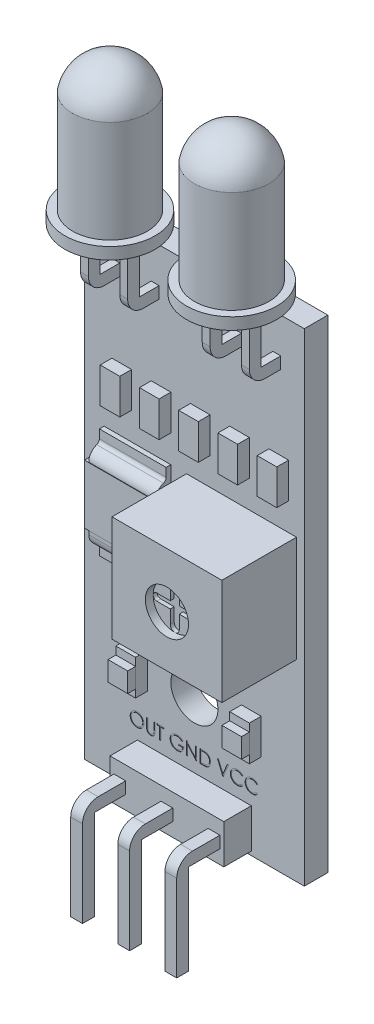
from build123d import *

# Parameters (mm, degrees)
SKETCH1_W               = 14.224
SKETCH1_H               = 31.242
BOSS_EXTRUDE1_DEPTH     = 0.762
SKETCH2_W               = 7.366
SKETCH2_H               = 2.54
BOSS_EXTRUDE2_DEPTH     = 1.778
BOSS_EXTRUDE3_START     = -4.318
SKETCH5_W               = 0.762
SKETCH5_H               = 0.762
BOSS_EXTRUDE3_DEPTH     = 6.35
SKETCH6_W               = 0.762
SKETCH6_H               = 0.762
BOSS_EXTRUDE4_DEPTH     = 6.604
LPATTERN1_COUNT         = 3
LPATTERN1_PITCH         = 3.048
CUT_EXTRUDE1_DEPTH      = 0.0254
CUT_EXTRUDE2_DEPTH      = 23.008773919
CUT_EXTRUDE2_DEPTH_BACK = 23.008773919
SKETCH8_R               = 1.524
SKETCH9_W               = 1.27
SKETCH9_H               = 2.286
BOSS_EXTRUDE5_DEPTH     = 0.762
SKETCH10_W              = 1.27
SKETCH10_H              = 1.27
BOSS_EXTRUDE6_DEPTH     = 0.508
LPATTERN2_START         = 3.048
LPATTERN2_OUTLINE_W     = 1.27
LPATTERN2_OUTLINE_H     = 0.508
LPATTERN2_DEPTH         = 1.27
LPATTERN2_START_2       = -9.779
LPATTERN2_2_OUTLINE_W   = 1.27
LPATTERN2_2_OUTLINE_H   = 0.762
LPATTERN2_2_DEPTH       = 2.286
SKETCH12_W              = 2.286
SKETCH12_H              = 1.27
BOSS_EXTRUDE7_DEPTH     = 0.762
LPATTERN3_COUNT         = 2
LPATTERN3_PITCH         = 5.842
SKETCH16_W              = 7.112
SKETCH16_H              = 6.858
BOSS_EXTRUDE9_DEPTH     = 4.826
SKETCH17_R              = 1.397
CUT_EXTRUDE3_DEPTH      = 0.508
CUT_EXTRUDE4_DEPTH      = 0.254
SKETCH19_W              = 1.27
SKETCH19_H              = 2.286
BOSS_EXTRUDE10_DEPTH    = 0.762
LPATTERN4_COUNT         = 5
LPATTERN4_PITCH         = 2.54
BOSS_EXTRUDE11_START    = -2.794
SKETCH20_W              = 0.508
SKETCH20_H              = 0.762
BOSS_EXTRUDE11_DEPTH    = 4.064
SKETCH21_W              = 0.508
SKETCH21_H              = 0.762
BOSS_EXTRUDE12_DEPTH    = 4.318
FILLET1_R               = 1.016
FILLET2_R               = 1.016
LPATTERN5_COUNT         = 2
LPATTERN5_PITCH         = 2.54
FILLET1_OF_LPATTERN5_R  = 1.016
LPATTERN6_START         = -5.334
LPATTERN6_OUTLINE_W     = 0.762
LPATTERN6_OUTLINE_H     = 1.27
LPATTERN6_DEPTH         = 0.508
LPATTERN6_START_2       = -2.794
LPATTERN6_2_OUTLINE_W   = 0.762
LPATTERN6_2_OUTLINE_H   = 1.27
LPATTERN6_2_DEPTH       = 0.508
SKETCH31_W              = 4.826
SKETCH31_H              = 3.81
BOSS_EXTRUDE14_DEPTH    = 1.016
SKETCH32_W              = 4.318
SKETCH32_H              = 7.112
BOSS_EXTRUDE15_DEPTH    = 0.9906
SKETCH33_W              = 4.318
SKETCH33_H              = 0.762
CUT_EXTRUDE5_DEPTH      = 0.6858
FILLET4_R               = 0.762
FILLET5_R               = 0.254


with BuildPart() as part:
    # Sketch1 → Boss-Extrude1 (new, symmetric)
    with BuildSketch(Plane.XY):
        Rectangle(SKETCH1_W, SKETCH1_H)
    extrude(amount=BOSS_EXTRUDE1_DEPTH, both=True)

    # Sketch2 → Boss-Extrude2 (add)
    with BuildSketch(Plane.XY.offset(0.762)):
        with Locations((0, -14.097)):
            Rectangle(SKETCH2_W, SKETCH2_H)
    extrude(amount=BOSS_EXTRUDE2_DEPTH)

    # Sketch5 → Boss-Extrude3 (add)
    with BuildSketch(Plane.XY.offset(2.54).offset(BOSS_EXTRUDE3_START)):
        with Locations((-3.048, -14.097)):
            Rectangle(SKETCH5_W, SKETCH5_H)
    boss_extrude3 = extrude(amount=BOSS_EXTRUDE3_DEPTH)

    # Sketch6 → Boss-Extrude4 (add)
    with BuildSketch(Plane(origin=(0, -13.716, 0), x_dir=(1, 0, 0), z_dir=(0, 1, 0))):
        with Locations((-3.048, -4.953)):
            Rectangle(SKETCH6_W, SKETCH6_H)
    boss_extrude4 = extrude(amount=-BOSS_EXTRUDE4_DEPTH)

    # LPattern1: Boss-Extrude3, Boss-Extrude4 ×3
    with Locations(*[(i * LPATTERN1_PITCH, 0, 0) for i in range(1, LPATTERN1_COUNT)]):
        add(boss_extrude3)
        add(boss_extrude4)

    # Sketch7 → Cut-Extrude1 (cut)
    # profile 1 of 9: a face of its own
    with BuildSketch(Plane.XY.offset(0.762)):
        with BuildLine():
            add(Edge.make_bspline(
                [(-3.713008127, -11.244319932), (-3.697330739, -11.244717014), (-3.666539056, -11.245496915), (-3.621284752, -11.251466907), (-3.578081752, -11.261795124), (-3.536578123, -11.275550549), (-3.497270302, -11.293900084), (-3.459862421, -11.316079156), (-3.424443486, -11.342320125), (-3.391490888, -11.372420145), (-3.361335781, -11.405170043), (-3.334768379, -11.440119934), (-3.312502912, -11.477058498), (-3.294218352, -11.515874733), (-3.279873738, -11.556480855), (-3.269975227, -11.599093343), (-3.263652285, -11.643436099), (-3.262913078, -11.67368069), (-3.262538087, -11.689023413)],
                knots=[0, 0, 0, 0, 1.065120563, 2.091984664, 3.0946048, 4.079830382, 5.057816894, 6.036188127, 7.030412546, 8.04752943, 9.064399622, 10.05169764, 11.02544977, 11.989514704, 12.962713494, 13.945757189, 14.957906945, 16, 16, 16, 16], degree=3))
            add(Edge.make_bspline(
                [(-3.262538087, -11.689023413), (-3.262913023, -11.704253118), (-3.263652065, -11.73427263), (-3.269982416, -11.778333992), (-3.279910429, -11.820689261), (-3.294085143, -11.861267729), (-3.312282543, -11.900112202), (-3.334696268, -11.937120471), (-3.361098044, -11.972304668), (-3.391144269, -12.005279348), (-3.423898423, -12.035516828), (-3.459030312, -12.06186482), (-3.495749836, -12.08453713), (-3.534529514, -12.102627655), (-3.574855042, -12.117086766), (-3.617087333, -12.12694502), (-3.661028495, -12.133303981), (-3.690993478, -12.134034174), (-3.70622394, -12.134405313)],
                knots=[0, 0, 0, 0, 1.043624062, 2.057103931, 3.04512605, 4.022047818, 4.998200453, 5.980619268, 6.982898556, 8.009068085, 9.034988726, 10.034168286, 11.015286542, 11.987931943, 12.962482838, 13.94673481, 14.956375938, 16, 16, 16, 16], degree=3))
            add(Edge.make_bspline(
                [(-3.70622394, -12.134405313), (-3.721566583, -12.134030509), (-3.751811017, -12.133291671), (-3.796209495, -12.126958265), (-3.838851917, -12.117054369), (-3.879616337, -12.10290066), (-3.918525487, -12.084608493), (-3.955655465, -12.062303817), (-3.990857237, -12.035837711), (-4.023838951, -12.005801229), (-4.054016373, -11.97310259), (-4.080325781, -11.938066497), (-4.102635473, -11.901380324), (-4.12086622, -11.86294226), (-4.135299336, -11.822938124), (-4.145146024, -11.781101068), (-4.151516816, -11.737669611), (-4.152250959, -11.708098475), (-4.152623468, -11.693093926)],
                knots=[0, 0, 0, 0, 1.053102029, 2.075944431, 3.073151272, 4.055350789, 5.033113405, 6.020478099, 7.024410459, 8.052272461, 9.079885166, 10.07527673, 11.055994387, 12.023226415, 12.992069828, 13.970394897, 14.97016774, 16, 16, 16, 16], degree=3))
            add(Edge.make_bspline(
                [(-4.152623468, -11.693093926), (-4.152494137, -11.683022786), (-4.152237107, -11.663007558), (-4.149142736, -11.633285545), (-4.144652572, -11.604041522), (-4.138217444, -11.575358648), (-4.129801175, -11.547307137), (-4.119870495, -11.519693526), (-4.107741429, -11.492797657), (-4.094030111, -11.466492115), (-4.07872678, -11.441186967), (-4.061823505, -11.417267527), (-4.043913999, -11.394533079), (-4.024280189, -11.373572758), (-4.003569166, -11.353776809), (-3.981444951, -11.335449449), (-3.958042544, -11.318425415), (-3.933261247, -11.303083734), (-3.907711685, -11.289208288), (-3.881373877, -11.277301289), (-3.854605528, -11.267081766), (-3.827281264, -11.258798748), (-3.799473643, -11.252259571), (-3.771121977, -11.247806745), (-3.74224885, -11.244704481), (-3.722796971, -11.244448667), (-3.713008127, -11.244319932)],
                knots=[0, 0, 0, 0, 1.037015668, 2.060948919, 3.074880161, 4.083647147, 5.086022904, 6.090072063, 7.104153813, 8.122640571, 9.144368836, 10.147691507, 11.138137339, 12.123020368, 13.103399296, 14.087645067, 15.080126199, 16.082011238, 17.087798457, 18.072939717, 19.057185487, 20.037253025, 21.01195951, 21.997135196, 22.992090687, 24, 24, 24, 24], degree=3))
        make_face()
        with BuildLine():
            add(Edge.make_bspline(
                [(-3.709276824, -11.33115753), (-3.717311601, -11.331255475), (-3.733304343, -11.331450428), (-3.757079838, -11.33401842), (-3.780542646, -11.337678412), (-3.803697613, -11.342899084), (-3.826447856, -11.350012064), (-3.849005435, -11.35819834), (-3.871164647, -11.368169917), (-3.89285234, -11.379436075), (-3.913877509, -11.391906003), (-3.93371677, -11.405687743), (-3.952421484, -11.420458097), (-3.969945853, -11.436251534), (-3.986238421, -11.453148484), (-4.001619861, -11.470892786), (-4.015473644, -11.489991622), (-4.028170154, -11.50992709), (-4.039531897, -11.530673223), (-4.049635134, -11.552011606), (-4.05789957, -11.574116302), (-4.064639611, -11.596747496), (-4.070227564, -11.619869346), (-4.07376758, -11.643657253), (-4.076363789, -11.667991687), (-4.076547599, -11.68443682), (-4.076640569, -11.692754716)],
                knots=[0, 0, 0, 0, 1.008559885, 2.007477868, 2.99961109, 3.989939068, 4.984837346, 5.991145699, 7.001802488, 8.033829008, 9.059044045, 10.069351652, 11.065060232, 12.050310815, 13.029377138, 14.011219647, 14.996725999, 15.989392538, 16.977580475, 17.965360261, 18.951710183, 19.937753436, 20.929683414, 21.935841486, 22.955955122, 24, 24, 24, 24], degree=3))
            add(Edge.make_bspline(
                [(-4.076640569, -11.692754716), (-4.076332174, -11.704985957), (-4.075725466, -11.729048591), (-4.070413825, -11.764310596), (-4.06223213, -11.798198616), (-4.050171396, -11.830527227), (-4.035088487, -11.861574317), (-4.016455318, -11.891064465), (-3.994379312, -11.919005642), (-3.969302614, -11.94520278), (-3.941889315, -11.969114049), (-3.912780257, -11.990102528), (-3.882287292, -12.007860816), (-3.850330902, -12.022327946), (-3.817081691, -12.033791748), (-3.782325411, -12.041648483), (-3.746293589, -12.046819307), (-3.721732842, -12.047315878), (-3.709276824, -12.047567715)],
                knots=[0, 0, 0, 0, 1.032063989, 2.030389145, 3.003944642, 3.970395727, 4.937377036, 5.913328081, 6.909231446, 7.93887556, 8.970685674, 9.976071282, 10.964166581, 11.944589148, 12.933237628, 13.927779006, 14.949070134, 16, 16, 16, 16], degree=3))
            add(Edge.make_bspline(
                [(-3.709276824, -12.047567715), (-3.700904622, -12.047452688), (-3.68430003, -12.047224556), (-3.659602639, -12.044926781), (-3.635350187, -12.041242119), (-3.611576689, -12.03593699), (-3.588309127, -12.029297381), (-3.565450387, -12.021409417), (-3.543243945, -12.011568441), (-3.521409663, -12.000695318), (-3.500510003, -11.988300081), (-3.480558781, -11.974986092), (-3.462058879, -11.960237494), (-3.44454762, -11.944678711), (-3.428188161, -11.927996029), (-3.413091132, -11.910211139), (-3.399307368, -11.891211782), (-3.38661568, -11.871306552), (-3.375293749, -11.850503651), (-3.365429092, -11.829087903), (-3.357060127, -11.807112041), (-3.35030409, -11.784544367), (-3.345009893, -11.761427745), (-3.341361989, -11.737731222), (-3.338810272, -11.713502203), (-3.338617939, -11.697114643), (-3.338520985, -11.688853809)],
                knots=[0, 0, 0, 0, 1.047197238, 2.076906641, 3.100256066, 4.114471768, 5.12198147, 6.126382909, 7.136867548, 8.15857795, 9.17633901, 10.174870724, 11.156907918, 12.133735059, 13.104061851, 14.077631395, 15.04955518, 16.038496417, 17.029181396, 18.010275684, 18.986308667, 19.968651475, 20.955262928, 21.950658345, 22.966943676, 24, 24, 24, 24], degree=3))
            add(Edge.make_bspline(
                [(-3.338520985, -11.688853809), (-3.338618016, -11.680649487), (-3.338810495, -11.664374705), (-3.34136077, -11.640314662), (-3.345013747, -11.616788649), (-3.350278249, -11.593889027), (-3.357063714, -11.571609957), (-3.365430553, -11.549972365), (-3.37529671, -11.528895642), (-3.386619842, -11.508431881), (-3.399347859, -11.488795327), (-3.413255988, -11.470022936), (-3.428584366, -11.452467246), (-3.444895041, -11.435694855), (-3.462595425, -11.420063481), (-3.481605338, -11.40556794), (-3.501693997, -11.391858406), (-3.522964012, -11.37949089), (-3.544915404, -11.368069544), (-3.567440112, -11.358284255), (-3.590282959, -11.349969476), (-3.613385856, -11.342877563), (-3.63694326, -11.337698859), (-3.660795993, -11.334015122), (-3.684911055, -11.331451322), (-3.701129127, -11.331255772), (-3.709276824, -11.33115753)],
                knots=[0, 0, 0, 0, 1.02996197, 2.043119294, 3.035359645, 4.018872909, 4.991431989, 5.957985074, 6.929999688, 7.912076566, 8.892894881, 9.867085534, 10.843653904, 11.817741046, 12.803660682, 13.806313499, 14.818574707, 15.856120519, 16.894564902, 17.924820532, 18.937903209, 19.946497019, 20.957711757, 21.963978472, 22.977135795, 24, 24, 24, 24], degree=3))
        make_face(mode=Mode.SUBTRACT)
    # profile 2 of 9: a face of its own
    with BuildSketch(Plane.XY.offset(0.762)):
        with BuildLine():
            Line((-3.08886289, -11.266029332), (-3.012879992, -11.266029332))
            Line((-3.012879992, -11.266029332), (-3.012879992, -11.773316941))
            add(Edge.make_bspline(
                [(-3.012879992, -11.773316941), (-3.0128913, -11.780496852), (-3.012912758, -11.794121969), (-3.012769426, -11.813515061), (-3.012368017, -11.830756207), (-3.012114946, -11.845911864), (-3.011551953, -11.85891249), (-3.011092806, -11.869828516), (-3.010502424, -11.878608256), (-3.009792889, -11.883732022), (-3.009487898, -11.885934451)],
                knots=[0, 0, 0, 0, 1.528628734, 2.90083645, 4.128790002, 5.200304208, 6.127813768, 6.898992206, 7.526736466, 8, 8, 8, 8], degree=3))
            add(Edge.make_bspline(
                [(-3.009487898, -11.885934451), (-3.008235447, -11.893880239), (-3.005801114, -11.909324098), (-2.999597134, -11.931315242), (-2.990932711, -11.95113485), (-2.980665538, -11.969401389), (-2.967135174, -11.985606432), (-2.950926701, -12.000534773), (-2.931289414, -12.013590809), (-2.909454946, -12.025529004), (-2.885921186, -12.035124175), (-2.86187313, -12.042379712), (-2.837672259, -12.046801465), (-2.821470408, -12.047313465), (-2.813424884, -12.047567715)],
                knots=[0, 0, 0, 0, 1.035780045, 2.013197591, 2.933192213, 3.817615948, 4.702609284, 5.640816605, 6.646850145, 7.73207398, 8.84249596, 9.914020372, 10.964143139, 12, 12, 12, 12], degree=3))
            add(Edge.make_bspline(
                [(-2.813424884, -12.047567715), (-2.806517599, -12.047307946), (-2.792742923, -12.046789907), (-2.772276227, -12.043581904), (-2.75234325, -12.037800244), (-2.732845564, -12.03033996), (-2.714569423, -12.020482925), (-2.69750463, -12.009096266), (-2.682273356, -11.995740493), (-2.668373994, -11.98096003), (-2.656270306, -11.964283166), (-2.645778621, -11.946073028), (-2.637184731, -11.926055569), (-2.632940869, -11.911987739), (-2.630760639, -11.904760571)],
                knots=[0, 0, 0, 0, 0.994687771, 1.983630487, 2.973142513, 3.978332533, 4.983357753, 5.956394766, 6.925816176, 7.893390482, 8.871859704, 9.88551698, 10.913711441, 12, 12, 12, 12], degree=3))
            add(Edge.make_bspline(
                [(-2.630760639, -11.904760571), (-2.630034895, -11.901773392), (-2.628417643, -11.895116755), (-2.626906454, -11.883863034), (-2.625332494, -11.870585037), (-2.624240398, -11.855187362), (-2.623175722, -11.837721604), (-2.62253877, -11.818096778), (-2.622244364, -11.796384144), (-2.622156629, -11.781231918), (-2.6221108, -11.773316941)],
                knots=[0, 0, 0, 0, 0.558680831, 1.244966039, 2.062412453, 2.990489873, 4.051219941, 5.244515665, 6.560634259, 8, 8, 8, 8], degree=3))
            Line((-2.6221108, -11.773316941), (-2.6221108, -11.266029332))
            Line((-2.6221108, -11.266029332), (-2.546127902, -11.266029332))
            Line((-2.546127902, -11.266029332), (-2.546127902, -11.777387454))
            add(Edge.make_bspline(
                [(-2.546127902, -11.777387454), (-2.546189375, -11.786603632), (-2.546309343, -11.804589564), (-2.547349673, -11.830945414), (-2.549008414, -11.85594699), (-2.551352008, -11.879597653), (-2.55445734, -11.901812771), (-2.557910583, -11.922787065), (-2.562308299, -11.942369977), (-2.567444759, -11.960714199), (-2.573316645, -11.978176216), (-2.580922408, -11.994748775), (-2.589491762, -12.010935685), (-2.599655306, -12.026492121), (-2.611075963, -12.041486962), (-2.624006178, -12.05582927), (-2.638018307, -12.069748238), (-2.653345284, -12.082886826), (-2.669734457, -12.094935781), (-2.687137074, -12.105530669), (-2.705419453, -12.114486858), (-2.72453407, -12.121859128), (-2.744489083, -12.127402278), (-2.765284994, -12.13153284), (-2.78696914, -12.133879871), (-2.801716779, -12.134228681), (-2.809184767, -12.134405313)],
                knots=[0, 0, 0, 0, 1.316592851, 2.569410997, 3.76748051, 4.895814652, 5.963796859, 6.97159953, 7.931736103, 8.829262218, 9.692595152, 10.560224239, 11.431080259, 12.30701507, 13.211635791, 14.121146779, 15.063487852, 16.031507147, 17.00238618, 17.966455255, 18.938106653, 19.907068911, 20.888905087, 21.893141452, 22.933117798, 24, 24, 24, 24], degree=3))
            add(Edge.make_bspline(
                [(-2.809184767, -12.134405313), (-2.817329482, -12.134215475), (-2.833309385, -12.133843012), (-2.856855924, -12.131708747), (-2.87942907, -12.127688679), (-2.901267233, -12.122569988), (-2.922073096, -12.115510304), (-2.942125413, -12.107261806), (-2.961080749, -12.097131498), (-2.979246616, -12.085860336), (-2.996137556, -12.073178568), (-3.011643021, -12.059356089), (-3.025788611, -12.044614323), (-3.038335895, -12.028793664), (-3.049492755, -12.012017158), (-3.059103682, -11.994237344), (-3.067355837, -11.975461105), (-3.071614949, -11.96240957), (-3.073768074, -11.955811581)],
                knots=[0, 0, 0, 0, 1.13879206, 2.234305948, 3.301075583, 4.341971843, 5.366689343, 6.369221514, 7.369726634, 8.367512178, 9.355451585, 10.318319045, 11.268648973, 12.207971039, 13.137398894, 14.081662264, 15.030215811, 16, 16, 16, 16], degree=3))
            add(Edge.make_bspline(
                [(-3.073768074, -11.955811581), (-3.075020453, -11.951304273), (-3.077736891, -11.941527821), (-3.080645867, -11.925347663), (-3.083091302, -11.90671739), (-3.085390742, -11.885635726), (-3.086747575, -11.862086332), (-3.087937127, -11.836079416), (-3.088871271, -11.807583531), (-3.088865762, -11.787734155), (-3.08886289, -11.777387454)],
                knots=[0, 0, 0, 0, 0.625038921, 1.35572334, 2.194682327, 3.136881307, 4.189498639, 5.346923369, 6.617055217, 8, 8, 8, 8], degree=3))
            Line((-3.08886289, -11.777387454), (-3.08886289, -11.266029332))
        make_face()
    # profile 3 of 9: a face of its own
    with BuildSketch(Plane.XY.offset(0.762)):
        Polygon((-2.426726205, -11.35286693), (-2.426726205, -11.266029332), (-1.981683514, -11.266029332), (-1.981683514, -11.35286693), (-2.16621341, -11.35286693), (-2.16621341, -12.112695914), (-2.242196308, -12.112695914), (-2.242196308, -11.35286693), align=None)
    # profile 4 of 9: a face of its own
    with BuildSketch(Plane.XY.offset(0.762)):
        with BuildLine():
            Line((-0.733393041, -11.410532522), (-0.798521239, -11.472268627))
            add(Edge.make_bspline(
                [(-0.798521239, -11.472268627), (-0.810306569, -11.461181924), (-0.833596201, -11.439272887), (-0.871565627, -11.410846421), (-0.911180826, -11.386494814), (-0.952235083, -11.366681308), (-0.99371172, -11.350872165), (-1.0350602, -11.339616788), (-1.075856395, -11.33243886), (-1.102990176, -11.331580493), (-1.116360417, -11.33115753)],
                knots=[0, 0, 0, 0, 1.08915593, 2.152340314, 3.188132944, 4.216796309, 5.218260357, 6.173443236, 7.099959455, 8, 8, 8, 8], degree=3))
            add(Edge.make_bspline(
                [(-1.116360417, -11.33115753), (-1.124564543, -11.331257583), (-1.140951519, -11.33145743), (-1.165292444, -11.334008126), (-1.189378085, -11.337676578), (-1.213162975, -11.342984423), (-1.23669336, -11.349711566), (-1.259887402, -11.358126334), (-1.282788368, -11.36793684), (-1.305180541, -11.379273094), (-1.326889194, -11.391726313), (-1.347392274, -11.405526625), (-1.366820466, -11.420231722), (-1.384808605, -11.436209767), (-1.401460163, -11.453316027), (-1.417171482, -11.471232292), (-1.431389988, -11.490448048), (-1.444232992, -11.51060975), (-1.455689992, -11.531363287), (-1.465803704, -11.552508903), (-1.474293856, -11.573976462), (-1.481011418, -11.595792901), (-1.486553614, -11.617789442), (-1.49045254, -11.640118391), (-1.492650661, -11.662803657), (-1.493030882, -11.677994612), (-1.493222024, -11.68563132)],
                knots=[0, 0, 0, 0, 1.02818874, 2.053710826, 3.065248034, 4.081641283, 5.106893873, 6.131558223, 7.173050175, 8.228653731, 9.27666206, 10.308777013, 11.325269123, 12.329503258, 13.32196095, 14.316845687, 15.314881793, 16.315733098, 17.311955233, 18.285320748, 19.252783886, 20.203351036, 21.145449891, 22.095197417, 23.042428769, 24, 24, 24, 24], degree=3))
            add(Edge.make_bspline(
                [(-1.493222024, -11.68563132), (-1.493039213, -11.693437783), (-1.492674088, -11.709029393), (-1.490337211, -11.732299195), (-1.486000285, -11.755223395), (-1.480202382, -11.777877322), (-1.472949881, -11.800299774), (-1.463909256, -11.822393541), (-1.453201198, -11.844157805), (-1.440806833, -11.865396464), (-1.427215124, -11.886084889), (-1.411988895, -11.905572619), (-1.395815003, -11.924119159), (-1.378104213, -11.941312723), (-1.35942444, -11.957613207), (-1.339217587, -11.972571513), (-1.317880994, -11.986475767), (-1.295382109, -11.999150734), (-1.271965057, -12.01047394), (-1.247954378, -12.020542958), (-1.223273366, -12.028835292), (-1.198051728, -12.035593652), (-1.172319529, -12.041133342), (-1.145946155, -12.044697199), (-1.119125521, -12.047283362), (-1.101045892, -12.047472451), (-1.091937342, -12.047567715)],
                knots=[0, 0, 0, 0, 0.93586088, 1.869166235, 2.799637598, 3.729985548, 4.670839027, 5.622275134, 6.589130586, 7.576015415, 8.568469353, 9.55398029, 10.53834874, 11.515998671, 12.510579167, 13.508179873, 14.527009472, 15.561807829, 16.601455013, 17.643573243, 18.680854198, 19.719860599, 20.772568776, 21.833555941, 22.908541556, 24, 24, 24, 24], degree=3))
            add(Edge.make_bspline(
                [(-1.091937342, -12.047567715), (-1.080960105, -12.04733825), (-1.059404516, -12.046887658), (-1.027718275, -12.043379969), (-0.997285917, -12.037901602), (-0.968192952, -12.029878615), (-0.940405592, -12.019645156), (-0.913821969, -12.00730913), (-0.88865138, -11.992397382), (-0.864818157, -11.975567134), (-0.842863564, -11.956815929), (-0.823062663, -11.936581939), (-0.80573128, -11.91496338), (-0.790611097, -11.892087582), (-0.778102529, -11.867765196), (-0.767835416, -11.842115417), (-0.759965458, -11.815126708), (-0.756734827, -11.796477877), (-0.75510244, -11.787054921)],
                knots=[0, 0, 0, 0, 1.13008108, 2.219097802, 3.278683437, 4.311054135, 5.322181354, 6.324827112, 7.324222904, 8.330512327, 9.32562643, 10.293043162, 11.24128371, 12.174520618, 13.111833804, 14.052305215, 15.015860969, 16, 16, 16, 16], degree=3))
            Line((-0.75510244, -11.787054921), (-1.037324634, -11.787054921))
            Line((-1.037324634, -11.787054921), (-1.037324634, -11.700217322))
            Line((-1.037324634, -11.700217322), (-0.679119542, -11.700217322))
            add(Edge.make_bspline(
                [(-0.679119542, -11.700217322), (-0.679532194, -11.716402561), (-0.680339831, -11.748079996), (-0.686004977, -11.79427661), (-0.695152971, -11.837909377), (-0.707649845, -11.879024249), (-0.723827292, -11.917562962), (-0.743511692, -11.953564644), (-0.767018089, -11.986796714), (-0.793509183, -12.01753047), (-0.823239265, -12.044945343), (-0.855405004, -12.069040492), (-0.890059544, -12.089336932), (-0.927170103, -12.105849509), (-0.966615194, -12.118736741), (-1.008486094, -12.127873864), (-1.052726019, -12.13334816), (-1.083045555, -12.134047598), (-1.098551925, -12.134405313)],
                knots=[0, 0, 0, 0, 1.140356446, 2.231883559, 3.274166699, 4.278491846, 5.25512956, 6.21435461, 7.1637429, 8.11826594, 9.068280886, 10.0076534, 10.945064095, 11.891975133, 12.864533718, 13.863980011, 14.907571808, 16, 16, 16, 16], degree=3))
            add(Edge.make_bspline(
                [(-1.098551925, -12.134405313), (-1.108109614, -12.13426764), (-1.126960457, -12.133996104), (-1.154801498, -12.132066346), (-1.1818749, -12.129095617), (-1.208176721, -12.124609463), (-1.233803708, -12.119114681), (-1.258627871, -12.112078466), (-1.282743776, -12.103933848), (-1.306188696, -12.094669943), (-1.328749832, -12.083936229), (-1.350527673, -12.072007994), (-1.3716426, -12.058946744), (-1.391950785, -12.044526598), (-1.41155804, -12.028855414), (-1.430337937, -12.011901782), (-1.448395613, -11.993717532), (-1.45970719, -11.980804896), (-1.465406856, -11.974298492)],
                knots=[0, 0, 0, 0, 1.107784379, 2.184907829, 3.233506516, 4.263428166, 5.276301166, 6.270063455, 7.25232949, 8.225834625, 9.190232166, 10.146266622, 11.1027726, 12.066435141, 13.031522626, 14.010570082, 14.99756817, 16, 16, 16, 16], degree=3))
            add(Edge.make_bspline(
                [(-1.465406856, -11.974298492), (-1.473676595, -11.963976258), (-1.490078804, -11.943503131), (-1.511191803, -11.910700862), (-1.529189855, -11.876736986), (-1.543793117, -11.841516956), (-1.555196044, -11.805073714), (-1.563373936, -11.767453828), (-1.568165414, -11.728608855), (-1.568855698, -11.702322212), (-1.569204923, -11.689023413)],
                knots=[0, 0, 0, 0, 1.023165419, 2.029347347, 3.013907458, 3.994755782, 4.975994455, 5.96558838, 6.970761222, 8, 8, 8, 8], degree=3))
            add(Edge.make_bspline(
                [(-1.569204923, -11.689023413), (-1.569076172, -11.679065102), (-1.568820306, -11.659275043), (-1.565717753, -11.629893944), (-1.561266363, -11.601034542), (-1.554723552, -11.572720425), (-1.546475504, -11.544932685), (-1.536181614, -11.517658418), (-1.524196469, -11.49088153), (-1.510266265, -11.46478633), (-1.494763931, -11.439719094), (-1.477939403, -11.415780733), (-1.459553772, -11.39340719), (-1.439907285, -11.372315117), (-1.418765539, -11.352769493), (-1.396326595, -11.334589357), (-1.37257316, -11.317750324), (-1.347430506, -11.302517622), (-1.321273907, -11.288834615), (-1.294166062, -11.276838749), (-1.266115245, -11.266924691), (-1.237331611, -11.258512749), (-1.207597285, -11.252292135), (-1.177128044, -11.247780915), (-1.145765067, -11.244694065), (-1.124565497, -11.244445809), (-1.113816346, -11.244319932)],
                knots=[0, 0, 0, 0, 1.008945113, 2.00506715, 2.99143336, 3.967273523, 4.948097931, 5.927297278, 6.919902385, 7.919676788, 8.923139349, 9.905703106, 10.883022732, 11.856032218, 12.825136022, 13.798837087, 14.781400844, 15.773989409, 16.776158564, 17.77167057, 18.775803737, 19.789618931, 20.80898985, 21.851988756, 22.910860228, 24, 24, 24, 24], degree=3))
            add(Edge.make_bspline(
                [(-1.113816346, -11.244319932), (-1.105050144, -11.244460114), (-1.087667794, -11.244738078), (-1.061801952, -11.246664764), (-1.036335911, -11.249718541), (-1.011231911, -11.253885782), (-0.98657544, -11.25956176), (-0.962296259, -11.26635403), (-0.938359171, -11.274262337), (-0.914839197, -11.283693923), (-0.89157819, -11.294399085), (-0.868446814, -11.306449188), (-0.845524103, -11.320050283), (-0.822770306, -11.335242756), (-0.800041939, -11.351765676), (-0.777698494, -11.37009161), (-0.755200642, -11.389497875), (-0.740734299, -11.403451469), (-0.733393041, -11.410532522)],
                knots=[0, 0, 0, 0, 0.985871117, 1.954866573, 2.915460327, 3.869826059, 4.81536089, 5.759505086, 6.70452669, 7.649098992, 8.607881297, 9.583363685, 10.581137262, 11.603961102, 12.659522466, 13.73993555, 14.853081303, 16, 16, 16, 16], degree=3))
        make_face()
    # profile 5 of 9: a face of its own
    with BuildSketch(Plane.XY.offset(0.762)):
        Polygon((-0.505444345, -12.112695914), (-0.505444345, -11.266029332), (-0.489501505, -11.266029332), (0.069854742, -11.932406135), (0.069854742, -11.266029332), (0.145837641, -11.266029332), (0.145837641, -12.112695914), (0.128537963, -12.112695914), (-0.429461447, -11.447845553), (-0.429461447, -12.112695914), align=None)
    # profile 6 of 9: a face of its own
    with BuildSketch(Plane.XY.offset(0.762)):
        with BuildLine():
            Line((0.362931636, -12.112695914), (0.362931636, -11.266029332))
            Line((0.362931636, -11.266029332), (0.533893158, -11.266029332))
            add(Edge.make_bspline(
                [(0.533893158, -11.266029332), (0.548762797, -11.266136391), (0.577490863, -11.26634323), (0.619004727, -11.267654691), (0.657415272, -11.26997467), (0.692596169, -11.273353964), (0.724644002, -11.277503364), (0.753469034, -11.282704414), (0.779220312, -11.288845933), (0.795057679, -11.29408207), (0.802546977, -11.296558175)],
                knots=[0, 0, 0, 0, 1.314313732, 2.53924729, 3.670748893, 4.714932338, 5.66265055, 6.526160246, 7.303039223, 8, 8, 8, 8], degree=3))
            add(Edge.make_bspline(
                [(0.802546977, -11.296558175), (0.812342846, -11.300290935), (0.831712447, -11.30767181), (0.85929131, -11.321594952), (0.885253824, -11.337370311), (0.909739214, -11.35501868), (0.932188174, -11.375039768), (0.953477701, -11.396583098), (0.97273688, -11.420432085), (0.990373742, -11.446092127), (1.00627551, -11.473260945), (1.020097743, -11.501886768), (1.031577089, -11.531824223), (1.041106497, -11.562990056), (1.048616782, -11.595452795), (1.053740792, -11.629250242), (1.05712044, -11.664248823), (1.057460087, -11.687997691), (1.057632421, -11.700047718)],
                knots=[0, 0, 0, 0, 0.984719456, 1.947108742, 2.898477687, 3.838006223, 4.779231079, 5.722358779, 6.681677486, 7.655904652, 8.64651281, 9.637519902, 10.640069247, 11.656948941, 12.698408672, 13.768548281, 14.867775369, 16, 16, 16, 16], degree=3))
            add(Edge.make_bspline(
                [(1.057632421, -11.700047718), (1.057480271, -11.710512816), (1.057180443, -11.731135386), (1.054488209, -11.761528514), (1.050575081, -11.791019984), (1.044516771, -11.81946936), (1.037162258, -11.847125898), (1.027736646, -11.873694838), (1.016939108, -11.89941991), (1.004347995, -11.923953277), (0.990525224, -11.9471963), (0.975691203, -11.96910695), (0.959861757, -11.989372573), (0.942885939, -12.00805454), (0.924983122, -12.025124688), (0.906036095, -12.040725612), (0.885995968, -12.054552053), (0.8649525, -12.067147333), (0.842291801, -12.078134733), (0.817584651, -12.087431134), (0.790725683, -12.095134981), (0.761780824, -12.101562607), (0.730700062, -12.106661306), (0.697452925, -12.110078547), (0.662090495, -12.112389447), (0.637808275, -12.112591774), (0.625310082, -12.112695914)],
                knots=[0, 0, 0, 0, 1.105936401, 2.179363191, 3.223086493, 4.248585256, 5.251745608, 6.245858792, 7.225916811, 8.198733463, 9.158002045, 10.082870192, 10.993790845, 11.873723703, 12.748670949, 13.606408763, 14.465103618, 15.319838547, 16.196477973, 17.123216899, 18.106603292, 19.147568657, 20.255746949, 21.433717677, 22.679120308, 24, 24, 24, 24], degree=3))
            Line((0.625310082, -12.112695914), (0.362931636, -12.112695914))
        make_face()
        with BuildLine():
            Line((0.438914535, -12.025858315), (0.536098018, -12.025858315))
            add(Edge.make_bspline(
                [(0.536098018, -12.025858315), (0.550062785, -12.0257983), (0.576922145, -12.025682868), (0.615544171, -12.024669963), (0.650833088, -12.023014866), (0.682793907, -12.02069861), (0.711408582, -12.017634012), (0.736736916, -12.014217131), (0.758695881, -12.009960224), (0.771983572, -12.006101611), (0.778123902, -12.004318521)],
                knots=[0, 0, 0, 0, 1.375205317, 2.645023457, 3.804390687, 4.853969522, 5.800190428, 6.637939096, 7.370582563, 8, 8, 8, 8], degree=3))
            add(Edge.make_bspline(
                [(0.778123902, -12.004318521), (0.785852363, -12.001596715), (0.801124689, -11.996218115), (0.823109254, -11.986407025), (0.843612375, -11.97478542), (0.862991369, -11.961867157), (0.880971339, -11.947196602), (0.897765362, -11.931092765), (0.913339625, -11.913473687), (0.927533218, -11.894361239), (0.940235226, -11.873874376), (0.951234931, -11.852214508), (0.960875206, -11.829618958), (0.968441645, -11.805740745), (0.974372081, -11.780793337), (0.978572682, -11.754774979), (0.981188815, -11.727690531), (0.981493965, -11.709268971), (0.981649523, -11.699878113)],
                knots=[0, 0, 0, 0, 0.998632004, 1.973411704, 2.929992603, 3.868527914, 4.809262121, 5.754881198, 6.702106254, 7.672490631, 8.653608572, 9.636854334, 10.631411391, 11.644891563, 12.686317036, 13.754757253, 14.855430412, 16, 16, 16, 16], degree=3))
            add(Edge.make_bspline(
                [(0.981649523, -11.699878113), (0.981525356, -11.68997611), (0.98128143, -11.670523538), (0.978215454, -11.64198103), (0.973735002, -11.614529523), (0.967255902, -11.588167181), (0.95899948, -11.562842573), (0.948695635, -11.53869576), (0.936922949, -11.515471728), (0.922915857, -11.493706502), (0.907575325, -11.473122076), (0.890550582, -11.454264413), (0.87211211, -11.437090555), (0.852461015, -11.421333047), (0.831043471, -11.407625835), (0.80836401, -11.395364487), (0.784089916, -11.384958739), (0.767201894, -11.379424234), (0.758619364, -11.376611585)],
                knots=[0, 0, 0, 0, 1.122418816, 2.205001699, 3.251619955, 4.274784885, 5.280384055, 6.268708349, 7.249350384, 8.229342522, 9.199999885, 10.157847722, 11.105861043, 12.055065948, 13.010012805, 13.98527497, 14.976112212, 16, 16, 16, 16], degree=3))
            add(Edge.make_bspline(
                [(0.758619364, -11.376611585), (0.751519182, -11.374648183), (0.736422249, -11.370473451), (0.7117868, -11.365919504), (0.684060852, -11.361902797), (0.653121309, -11.358502091), (0.619003437, -11.35606192), (0.581680998, -11.354230383), (0.54113786, -11.352995065), (0.513032754, -11.352910711), (0.498445779, -11.35286693)],
                knots=[0, 0, 0, 0, 0.674548936, 1.434276114, 2.292660221, 3.240891867, 4.284742987, 5.42552168, 6.663806718, 8, 8, 8, 8], degree=3))
            Line((0.498445779, -11.35286693), (0.438914535, -11.35286693))
            Line((0.438914535, -11.35286693), (0.438914535, -12.025858315))
        make_face(mode=Mode.SUBTRACT)
    # profile 7 of 9: a face of its own
    with BuildSketch(Plane.XY.offset(0.762)):
        Polygon((1.491820412, -11.266029332), (1.57323066, -11.266029332), (1.855452854, -11.933254158), (2.137675048, -11.266029332), (2.219085297, -11.266029332), (1.860880204, -12.112695914), (1.850025505, -12.112695914), align=None)
    # profile 8 of 9: a face of its own
    with BuildSketch(Plane.XY.offset(0.762)):
        with BuildLine():
            Line((3.152589477, -11.421387222), (3.086104441, -11.472268627))
            add(Edge.make_bspline(
                [(3.086104441, -11.472268627), (3.081361684, -11.466616288), (3.071940112, -11.455387817), (3.056782554, -11.439620576), (3.040985777, -11.4248486), (3.02455582, -11.411001518), (3.007196949, -11.398563559), (2.989329672, -11.38688655), (2.970655099, -11.37641988), (2.944831348, -11.363728835), (2.911049872, -11.35048548), (2.868524268, -11.339381271), (2.824132064, -11.33231253), (2.793846171, -11.33154694), (2.778441544, -11.33115753)],
                knots=[0, 0, 0, 0, 0.757959112, 1.505699292, 2.245454638, 2.979532153, 3.711538275, 4.438200793, 5.171680507, 5.909471876, 7.393775596, 8.890124382, 10.418191784, 12, 12, 12, 12], degree=3))
            add(Edge.make_bspline(
                [(2.778441544, -11.33115753), (2.769954728, -11.331255251), (2.753059861, -11.331449785), (2.727986804, -11.334016182), (2.703381935, -11.337623275), (2.679261259, -11.342975495), (2.655655479, -11.349742204), (2.632410272, -11.35782797), (2.609862186, -11.367831902), (2.5876993, -11.378888947), (2.566465093, -11.39137787), (2.546373684, -11.405000337), (2.527498348, -11.419603907), (2.509824156, -11.435243316), (2.493333039, -11.451848131), (2.478144491, -11.469595313), (2.46431107, -11.488428123), (2.451558571, -11.508098221), (2.440137588, -11.528548314), (2.430575122, -11.549854091), (2.422107218, -11.5716507), (2.41540664, -11.594184407), (2.410102995, -11.617296655), (2.406443542, -11.641049472), (2.403906331, -11.665393235), (2.403712764, -11.681893391), (2.403615193, -11.690210646)],
                knots=[0, 0, 0, 0, 1.054917814, 2.100044995, 3.131103042, 4.146048494, 5.169673617, 6.183595914, 7.203665975, 8.234915748, 9.262203917, 10.264457458, 11.251630812, 12.227803204, 13.197192746, 14.159520551, 15.12972552, 16.100847026, 17.073214652, 18.039054194, 19.002613845, 19.979014051, 20.95965708, 21.949030935, 22.966165397, 24, 24, 24, 24], degree=3))
            add(Edge.make_bspline(
                [(2.403615193, -11.690210646), (2.403920433, -11.702724697), (2.404519731, -11.727294377), (2.409853328, -11.763282693), (2.417958368, -11.797759119), (2.430105754, -11.830508144), (2.445084265, -11.861933592), (2.46401104, -11.891503749), (2.48593161, -11.919665468), (2.511156086, -11.945753188), (2.538831395, -11.969584125), (2.568524696, -11.990569501), (2.600162035, -12.008062814), (2.633394093, -12.022619661), (2.668476597, -12.033809382), (2.70534646, -12.041686798), (2.743923491, -12.046825382), (2.770283705, -12.047317341), (2.783699289, -12.047567715)],
                knots=[0, 0, 0, 0, 1.029171465, 2.020641659, 2.987623507, 3.938342917, 4.889210282, 5.84687017, 6.821220943, 7.821438502, 8.827599549, 9.822697543, 10.807740252, 11.797342354, 12.80366471, 13.83203677, 14.896651826, 16, 16, 16, 16], degree=3))
            add(Edge.make_bspline(
                [(2.783699289, -12.047567715), (2.798480319, -12.047159191), (2.827572922, -12.046355119), (2.870237183, -12.039543263), (2.911079355, -12.028498396), (2.950101634, -12.013041186), (2.987194011, -11.992947299), (3.022414533, -11.968588006), (3.055792929, -11.939731593), (3.075864075, -11.917698153), (3.086104441, -11.906456618)],
                knots=[0, 0, 0, 0, 1.028121516, 2.023589091, 2.998037872, 3.967518031, 4.937445131, 5.927275754, 6.942489185, 8, 8, 8, 8], degree=3))
            Line((3.086104441, -11.906456618), (3.152589477, -11.956829209))
            add(Edge.make_bspline(
                [(3.152589477, -11.956829209), (3.147239001, -11.963732796), (3.136563679, -11.977506901), (3.119277646, -11.996925008), (3.101067711, -12.015189792), (3.081798617, -12.032153996), (3.06169203, -12.048157075), (3.04038692, -12.062744373), (3.018163366, -12.0761195), (2.995096666, -12.088366393), (2.971211327, -12.099232088), (2.946535971, -12.108534237), (2.921176958, -12.116547304), (2.89513313, -12.123139677), (2.868350463, -12.128285253), (2.840925609, -12.13172506), (2.812799375, -12.134081675), (2.793824024, -12.134296466), (2.784208103, -12.134405313)],
                knots=[0, 0, 0, 0, 0.986787822, 1.968848986, 2.935600012, 3.899624008, 4.868462664, 5.837806735, 6.815139263, 7.798259679, 8.787526145, 9.778297419, 10.776456485, 11.791383307, 12.812564526, 13.85620153, 14.913611965, 16, 16, 16, 16], degree=3))
            add(Edge.make_bspline(
                [(2.784208103, -12.134405313), (2.775101922, -12.134341936), (2.757095576, -12.134216615), (2.730510547, -12.13218651), (2.704629261, -12.129416765), (2.679525687, -12.125246295), (2.655062835, -12.120324903), (2.631462467, -12.113727857), (2.608492352, -12.106337869), (2.586244774, -12.097652282), (2.564700811, -12.087851226), (2.543929948, -12.076774031), (2.523941739, -12.064513848), (2.504539668, -12.051340922), (2.486010349, -12.036832129), (2.468193213, -12.021188964), (2.450988349, -12.004464151), (2.440343891, -11.992404026), (2.434992059, -11.986340424)],
                knots=[0, 0, 0, 0, 1.114604814, 2.203992996, 3.262667896, 4.300477797, 5.318619304, 6.316056647, 7.298880507, 8.271930387, 9.238335007, 10.195173496, 11.151986948, 12.108099108, 13.064862484, 14.031167946, 15.010108607, 16, 16, 16, 16], degree=3))
            add(Edge.make_bspline(
                [(2.434992059, -11.986340424), (2.426420009, -11.975807604), (2.409379398, -11.954869126), (2.387577569, -11.920933282), (2.36891521, -11.885501929), (2.353826179, -11.848388921), (2.342030243, -11.809677538), (2.333858411, -11.769348265), (2.328548214, -11.727438767), (2.327940964, -11.69893349), (2.327632294, -11.684444087)],
                knots=[0, 0, 0, 0, 0.994628077, 1.977248131, 2.950237994, 3.925870899, 4.908910175, 5.911660606, 6.938484602, 8, 8, 8, 8], degree=3))
            add(Edge.make_bspline(
                [(2.327632294, -11.684444087), (2.328008503, -11.669214864), (2.32874867, -11.63925232), (2.335037176, -11.595280339), (2.345153341, -11.553152291), (2.35952173, -11.512946818), (2.377738451, -11.474452449), (2.40024203, -11.437963247), (2.426771031, -11.403245853), (2.457117392, -11.37082705), (2.490395582, -11.3411842), (2.526032701, -11.315105368), (2.563958997, -11.293402276), (2.603756645, -11.275260349), (2.645723653, -11.26131588), (2.689770483, -11.251554253), (2.735814368, -11.245478304), (2.767228704, -11.244710206), (2.783190475, -11.244319932)],
                knots=[0, 0, 0, 0, 1.032925535, 2.032216505, 3.007276963, 3.968222605, 4.92396291, 5.891752235, 6.871517503, 7.883894988, 8.900124299, 9.891468569, 10.874487609, 11.85992873, 12.854644235, 13.869047385, 14.917252991, 16, 16, 16, 16], degree=3))
            add(Edge.make_bspline(
                [(2.783190475, -11.244319932), (2.792918547, -11.244436564), (2.812174284, -11.244667424), (2.840659209, -11.246918624), (2.868391731, -11.250671439), (2.895390956, -11.255779516), (2.921788234, -11.262119191), (2.947381813, -11.270377891), (2.972321874, -11.279821013), (2.996451124, -11.290696679), (3.019653792, -11.302904823), (3.041922651, -11.316310125), (3.063080815, -11.330895966), (3.083277163, -11.346538294), (3.102173844, -11.363568039), (3.120307381, -11.381516789), (3.137061964, -11.400901541), (3.147404165, -11.414546162), (3.152589477, -11.421387222)],
                knots=[0, 0, 0, 0, 1.096760587, 2.17092713, 3.219439832, 4.250915756, 5.268269357, 6.278326846, 7.281116186, 8.274029601, 9.260640565, 10.235837813, 11.203064059, 12.156899882, 13.114053108, 14.069676657, 15.032185724, 16, 16, 16, 16], degree=3))
        make_face()
    # profile 9 of 9: a face of its own
    with BuildSketch(Plane.XY.offset(0.762)):
        with BuildLine():
            Line((4.107803057, -11.421387222), (4.04131802, -11.472268627))
            add(Edge.make_bspline(
                [(4.04131802, -11.472268627), (4.036575263, -11.466616288), (4.027153691, -11.455387817), (4.011996133, -11.439620576), (3.996199357, -11.4248486), (3.979769399, -11.411001518), (3.962410528, -11.398563559), (3.944543251, -11.38688655), (3.925868678, -11.37641988), (3.900044928, -11.363728835), (3.866263452, -11.35048548), (3.823737847, -11.339381271), (3.779345643, -11.33231253), (3.749059751, -11.33154694), (3.733655124, -11.33115753)],
                knots=[0, 0, 0, 0, 0.757959112, 1.505699292, 2.245454638, 2.979532153, 3.711538275, 4.438200793, 5.171680507, 5.909471876, 7.393775596, 8.890124382, 10.418191784, 12, 12, 12, 12], degree=3))
            add(Edge.make_bspline(
                [(3.733655124, -11.33115753), (3.725168308, -11.331255251), (3.708273441, -11.331449785), (3.683200384, -11.334016182), (3.658595515, -11.337623275), (3.634474839, -11.342975495), (3.610869059, -11.349742204), (3.587623851, -11.35782797), (3.565075766, -11.367831902), (3.54291288, -11.378888947), (3.521678673, -11.39137787), (3.501587263, -11.405000337), (3.482711928, -11.419603907), (3.465037736, -11.435243316), (3.448546619, -11.451848131), (3.433358071, -11.469595313), (3.419524649, -11.488428123), (3.406772151, -11.508098221), (3.395351167, -11.528548314), (3.385788702, -11.549854091), (3.377320797, -11.5716507), (3.370620219, -11.594184407), (3.365316575, -11.617296655), (3.361657121, -11.641049472), (3.35911991, -11.665393235), (3.358926344, -11.681893391), (3.358828772, -11.690210646)],
                knots=[0, 0, 0, 0, 1.054917814, 2.100044995, 3.131103042, 4.146048494, 5.169673617, 6.183595914, 7.203665975, 8.234915748, 9.262203917, 10.264457458, 11.251630812, 12.227803204, 13.197192746, 14.159520551, 15.12972552, 16.100847026, 17.073214652, 18.039054194, 19.002613845, 19.979014051, 20.95965708, 21.949030935, 22.966165397, 24, 24, 24, 24], degree=3))
            add(Edge.make_bspline(
                [(3.358828772, -11.690210646), (3.359134012, -11.702724697), (3.359733311, -11.727294377), (3.365066907, -11.763282693), (3.373171948, -11.797759119), (3.385319334, -11.830508144), (3.400297845, -11.861933592), (3.41922462, -11.891503749), (3.441145189, -11.919665468), (3.466369666, -11.945753188), (3.494044974, -11.969584125), (3.523738276, -11.990569501), (3.555375615, -12.008062814), (3.588607672, -12.022619661), (3.623690176, -12.033809382), (3.660560039, -12.041686798), (3.69913707, -12.046825382), (3.725497285, -12.047317341), (3.738912869, -12.047567715)],
                knots=[0, 0, 0, 0, 1.029171465, 2.020641659, 2.987623507, 3.938342917, 4.889210282, 5.84687017, 6.821220943, 7.821438502, 8.827599549, 9.822697543, 10.807740252, 11.797342354, 12.80366471, 13.83203677, 14.896651826, 16, 16, 16, 16], degree=3))
            add(Edge.make_bspline(
                [(3.738912869, -12.047567715), (3.753693899, -12.047159191), (3.782786502, -12.046355119), (3.825450763, -12.039543263), (3.866292935, -12.028498396), (3.905315214, -12.013041186), (3.942407591, -11.992947299), (3.977628113, -11.968588006), (4.011006509, -11.939731593), (4.031077655, -11.917698153), (4.04131802, -11.906456618)],
                knots=[0, 0, 0, 0, 1.028121516, 2.023589091, 2.998037872, 3.967518031, 4.937445131, 5.927275754, 6.942489185, 8, 8, 8, 8], degree=3))
            Line((4.04131802, -11.906456618), (4.107803057, -11.956829209))
            add(Edge.make_bspline(
                [(4.107803057, -11.956829209), (4.102452581, -11.963732796), (4.091777258, -11.977506901), (4.074491225, -11.996925008), (4.056281291, -12.015189792), (4.037012197, -12.032153996), (4.016905609, -12.048157075), (3.9956005, -12.062744373), (3.973376946, -12.0761195), (3.950310245, -12.088366393), (3.926424907, -12.099232088), (3.901749551, -12.108534237), (3.876390538, -12.116547304), (3.850346709, -12.123139677), (3.823564043, -12.128285253), (3.796139188, -12.13172506), (3.768012955, -12.134081675), (3.749037603, -12.134296466), (3.739421683, -12.134405313)],
                knots=[0, 0, 0, 0, 0.986787822, 1.968848986, 2.935600012, 3.899624008, 4.868462664, 5.837806735, 6.815139263, 7.798259679, 8.787526145, 9.778297419, 10.776456485, 11.791383307, 12.812564526, 13.85620153, 14.913611965, 16, 16, 16, 16], degree=3))
            add(Edge.make_bspline(
                [(3.739421683, -12.134405313), (3.730315502, -12.134341936), (3.712309156, -12.134216615), (3.685724127, -12.13218651), (3.65984284, -12.129416765), (3.634739267, -12.125246295), (3.610276414, -12.120324903), (3.586676047, -12.113727857), (3.563705932, -12.106337869), (3.541458354, -12.097652282), (3.519914391, -12.087851226), (3.499143528, -12.076774031), (3.479155319, -12.064513848), (3.459753248, -12.051340922), (3.441223929, -12.036832129), (3.423406792, -12.021188964), (3.406201928, -12.004464151), (3.39555747, -11.992404026), (3.390205639, -11.986340424)],
                knots=[0, 0, 0, 0, 1.114604814, 2.203992996, 3.262667896, 4.300477797, 5.318619304, 6.316056647, 7.298880507, 8.271930387, 9.238335007, 10.195173496, 11.151986948, 12.108099108, 13.064862484, 14.031167946, 15.010108607, 16, 16, 16, 16], degree=3))
            add(Edge.make_bspline(
                [(3.390205639, -11.986340424), (3.381633589, -11.975807604), (3.364592978, -11.954869126), (3.342791148, -11.920933282), (3.324128789, -11.885501929), (3.309039758, -11.848388921), (3.297243822, -11.809677538), (3.289071991, -11.769348265), (3.283761794, -11.727438767), (3.283154543, -11.69893349), (3.282845874, -11.684444087)],
                knots=[0, 0, 0, 0, 0.994628077, 1.977248131, 2.950237994, 3.925870899, 4.908910175, 5.911660606, 6.938484602, 8, 8, 8, 8], degree=3))
            add(Edge.make_bspline(
                [(3.282845874, -11.684444087), (3.283222083, -11.669214864), (3.28396225, -11.63925232), (3.290250756, -11.595280339), (3.300366921, -11.553152291), (3.31473531, -11.512946818), (3.332952031, -11.474452449), (3.35545561, -11.437963247), (3.381984611, -11.403245853), (3.412330972, -11.37082705), (3.445609162, -11.3411842), (3.481246281, -11.315105368), (3.519172577, -11.293402276), (3.558970224, -11.275260349), (3.600937233, -11.26131588), (3.644984062, -11.251554253), (3.691027948, -11.245478304), (3.722442284, -11.244710206), (3.738404055, -11.244319932)],
                knots=[0, 0, 0, 0, 1.032925535, 2.032216505, 3.007276963, 3.968222605, 4.92396291, 5.891752235, 6.871517503, 7.883894988, 8.900124299, 9.891468569, 10.874487609, 11.85992873, 12.854644235, 13.869047385, 14.917252991, 16, 16, 16, 16], degree=3))
            add(Edge.make_bspline(
                [(3.738404055, -11.244319932), (3.748132126, -11.244436564), (3.767387864, -11.244667424), (3.795872788, -11.246918624), (3.82360531, -11.250671439), (3.850604536, -11.255779516), (3.877001813, -11.262119191), (3.902595393, -11.270377891), (3.927535454, -11.279821013), (3.951664703, -11.290696679), (3.974867371, -11.302904823), (3.997136231, -11.316310125), (4.018294395, -11.330895966), (4.038490743, -11.346538294), (4.057387424, -11.363568039), (4.075520961, -11.381516789), (4.092275544, -11.400901541), (4.102617744, -11.414546162), (4.107803057, -11.421387222)],
                knots=[0, 0, 0, 0, 1.096760587, 2.17092713, 3.219439832, 4.250915756, 5.268269357, 6.278326846, 7.281116186, 8.274029601, 9.260640565, 10.235837813, 11.203064059, 12.156899882, 13.114053108, 14.069676657, 15.032185724, 16, 16, 16, 16], degree=3))
        make_face()
    extrude(amount=-CUT_EXTRUDE1_DEPTH, mode=Mode.SUBTRACT)

    # Sketch8 → Cut-Extrude2 (cut, two sides: drawn at the far end of the back side and taken through both)
    with BuildSketch(Plane.XY.offset(0.762).offset(-CUT_EXTRUDE2_DEPTH_BACK)):
        with Locations(Location((0, -8.509, 0), (0, 0, 180))):
            Circle(SKETCH8_R)
    extrude(amount=CUT_EXTRUDE2_DEPTH + CUT_EXTRUDE2_DEPTH_BACK, mode=Mode.SUBTRACT)

    # Sketch9 → Boss-Extrude5 (add)
    with BuildSketch(Plane.XY.offset(0.762)):
        with Locations((-3.683, -8.636)):
            Rectangle(SKETCH9_W, SKETCH9_H)
    extrude(amount=BOSS_EXTRUDE5_DEPTH)

    # LPattern2 2 outline → LPattern2 2 (add)
    with BuildSketch(Plane(origin=(0, 0, 0), x_dir=(1, 0, 0), z_dir=(0, 1, 0)).offset(LPATTERN2_START_2)):
        with Locations((3.683, -1.143)):
            Rectangle(LPATTERN2_2_OUTLINE_W, LPATTERN2_2_OUTLINE_H)
    extrude(amount=LPATTERN2_2_DEPTH)

    # Sketch12 → Boss-Extrude7 (add)
    with BuildSketch(Plane.XY.offset(0.762)):
        with Locations((-2.921, -4.826)):
            Rectangle(SKETCH12_W, SKETCH12_H)
    boss_extrude7 = extrude(amount=BOSS_EXTRUDE7_DEPTH)

    # LPattern3: Boss-Extrude7 ×2
    with Locations(*[(i * LPATTERN3_PITCH, 0, 0) for i in range(1, LPATTERN3_COUNT)]):
        add(boss_extrude7)

    # Sketch16 → Boss-Extrude9 (add)
    with BuildSketch(Plane.XY.offset(0.762)):
        with Locations((3.048, 0.254)):
            Rectangle(SKETCH16_W, SKETCH16_H)
    extrude(amount=BOSS_EXTRUDE9_DEPTH)

    # Sketch17 → Cut-Extrude3 (cut)
    with BuildSketch(Plane.XY.offset(5.588)):
        with Locations((3.048, 0.127)):
            Circle(SKETCH17_R)
    extrude(amount=-CUT_EXTRUDE3_DEPTH, mode=Mode.SUBTRACT)

    # Sketch18 → Cut-Extrude4 (cut)
    with BuildSketch(Plane.XY.offset(5.08)):
        with BuildLine():
            Line((2.757000791, -0.979000791), (2.757000791, -0.102851416))
            Line((2.757000791, -0.102851416), (1.880851416, -0.102851416))
            ThreePointArc((1.880851416, -0.102851416), (1.651, 0.127), (1.880851416, 0.356851416))
            Line((1.880851416, 0.356851416), (2.757000791, 0.356851416))
            Line((2.757000791, 0.356851416), (2.757000791, 1.233000791))
            ThreePointArc((2.757000791, 1.233000791), (3.048, 1.524), (3.338999209, 1.233000791))
            Line((3.338999209, 1.233000791), (3.338999209, 0.356851416))
            Line((3.338999209, 0.356851416), (4.215148584, 0.356851416))
            ThreePointArc((4.215148584, 0.356851416), (4.445, 0.127), (4.215148584, -0.102851416))
            Line((4.215148584, -0.102851416), (3.338999209, -0.102851416))
            Line((3.338999209, -0.102851416), (3.338999209, -0.979000791))
            ThreePointArc((3.338999209, -0.979000791), (3.048, -1.27), (2.757000791, -0.979000791))
        make_face()
    extrude(amount=-CUT_EXTRUDE4_DEPTH, mode=Mode.SUBTRACT)

    # Sketch19 → Boss-Extrude10 (add)
    with BuildSketch(Plane.XY.offset(0.762)):
        with Locations((5.461, 6.604)):
            Rectangle(SKETCH19_W, SKETCH19_H)
    boss_extrude10 = extrude(amount=BOSS_EXTRUDE10_DEPTH)

    # LPattern4: Boss-Extrude10 ×5
    with Locations(*[(-i * LPATTERN4_PITCH, 0, 0) for i in range(1, LPATTERN4_COUNT)]):
        add(boss_extrude10)

    # Sketch20 → Boss-Extrude11 (add)
    with BuildSketch(Plane.XY.offset(0.762).offset(BOSS_EXTRUDE11_START)):
        with Locations((5.334, 12.954)):
            Rectangle(SKETCH20_W, SKETCH20_H)
    boss_extrude11 = extrude(amount=BOSS_EXTRUDE11_DEPTH)

    # Sketch21 → Boss-Extrude12 (add)
    with BuildSketch(Plane(origin=(0, 12.573, 0), x_dir=(-1, 0, 0), z_dir=(0, -1, 0))):
        with Locations((-5.334, -2.413)):
            Rectangle(SKETCH21_W, SKETCH21_H)
    boss_extrude12 = extrude(amount=-BOSS_EXTRUDE12_DEPTH)

    # Fillet1
    fillet1_edges = [part.edges().sort_by_distance(p)[0] for p in [
        (5.334, 12.573, 2.794),
    ]]
    fillet(fillet1_edges, radius=FILLET1_R)

    # Fillet2
    fillet2_edges = [part.edges().sort_by_distance(p)[0] for p in [
        (0, -13.716, 5.334),
        (3.048, -13.716, 5.334),
        (-3.048, -13.716, 5.334),
    ]]
    fillet(fillet2_edges, radius=FILLET2_R)

    # LPattern5: Boss-Extrude11, Boss-Extrude12 ×2
    with Locations(*[(-i * LPATTERN5_PITCH, 0, 0) for i in range(1, LPATTERN5_COUNT)]):
        add(boss_extrude11)
        add(boss_extrude12)

    # Fillet1 of LPattern5
    fillet1_of_lpattern5_edges = [part.edges().sort_by_distance(p)[0] for p in [
        (2.794, 12.573, 2.794),
    ]]
    fillet(fillet1_of_lpattern5_edges, radius=FILLET1_OF_LPATTERN5_R)

    # Sketch29 → Revolve2 (revolve)
    with BuildSketch(Plane(origin=(0, 0, 2.413), x_dir=(-1, 0, 0), z_dir=(0, 0, -1))):
        with BuildLine():
            Line((-4.064, 16.891), (-6.985, 16.891))
            Line((-6.985, 16.891), (-6.985, 17.653))
            Line((-6.985, 17.653), (-6.477, 17.653))
            Line((-6.477, 17.653), (-6.477, 24.257))
            ThreePointArc((-6.477, 24.257), (-5.641307278, 25.713333643), (-4.064, 26.289))
            Line((-4.064, 26.289), (-4.064, 16.891))
        make_face()
    revolve(axis=Axis((4.064, 16.891, 2.413), (0, 1, 0)))

    # LPattern6: read off the stored shape, not the designer's step
    # LPattern6 outline → LPattern6 (add)
    with BuildSketch(Plane.YZ.offset(LPATTERN6_START)):
        with Locations((12.954, -1.397)):
            Rectangle(LPATTERN6_OUTLINE_W, LPATTERN6_OUTLINE_H)
        with BuildLine():
            Line((12.573, 0.762), (13.335, 0.762))
            Line((13.335, 0.762), (13.335, 2.032))
            Line((13.335, 2.032), (16.891, 2.032))
            Line((16.891, 2.032), (16.891, 2.794))
            Line((16.891, 2.794), (13.589, 2.794))
            ThreePointArc((13.589, 2.794), (12.87057951, 2.49642049), (12.573, 1.778))
            Line((12.573, 1.778), (12.573, 0.762))
        make_face()
    extrude(amount=LPATTERN6_DEPTH)

    # LPattern6 2 outline → LPattern6 2 (add)
    with BuildSketch(Plane.YZ.offset(LPATTERN6_START_2)):
        with Locations((12.954, -1.397)):
            Rectangle(LPATTERN6_2_OUTLINE_W, LPATTERN6_2_OUTLINE_H)
        with BuildLine():
            Line((12.573, 0.762), (13.335, 0.762))
            Line((13.335, 0.762), (13.335, 2.032))
            Line((13.335, 2.032), (16.891, 2.032))
            Line((16.891, 2.032), (16.891, 2.794))
            Line((16.891, 2.794), (13.589, 2.794))
            ThreePointArc((13.589, 2.794), (12.87057951, 2.49642049), (12.573, 1.778))
            Line((12.573, 1.778), (12.573, 0.762))
        make_face()
    extrude(amount=LPATTERN6_2_DEPTH)

    # LPattern6 3 outline → LPattern6 3 (revolve)
    with BuildSketch(Plane(origin=(-3.81, 0, 2.413), x_dir=(1, 0, 0), z_dir=(0, 0, 1))):
        with BuildLine():
            Line((2.921, 16.891), (2.921, 17.653))
            Line((2.921, 17.653), (2.413, 17.653))
            Line((2.413, 17.653), (2.413, 24.256999998))
            ThreePointArc((2.413, 24.256999998), (1.577307279, 25.713333642), (0, 26.289))
            Line((0, 26.289), (0, 16.891))
            Line((0, 16.891), (2.921, 16.891))
        make_face()
    revolve(axis=Axis((-3.81, 0, 2.413), (0, 1, 0)))

    # Sketch31 → Boss-Extrude14 (add)
    with BuildSketch(Plane.XY.offset(0.762)):
        with Locations((-3.683, 0.254)):
            Rectangle(SKETCH31_W, SKETCH31_H)
    extrude(amount=BOSS_EXTRUDE14_DEPTH)

    # Sketch32 → Boss-Extrude15 (add)
    with BuildSketch(Plane.XY.offset(0.762)):
        with Locations((-3.683, 0.127)):
            Rectangle(SKETCH32_W, SKETCH32_H)
    extrude(amount=BOSS_EXTRUDE15_DEPTH)

    # Sketch33 → Cut-Extrude5 (cut)
    with BuildSketch(Plane.XY.offset(1.7526)):
        with Locations((-3.683, -3.048)):
            Rectangle(SKETCH33_W, SKETCH33_H)
        with Locations((-3.683, 3.302)):
            Rectangle(SKETCH33_W, SKETCH33_H)
    extrude(amount=-CUT_EXTRUDE5_DEPTH, mode=Mode.SUBTRACT)

    # Fillet4
    # the kernel refuses this fillet: 0.762 mm, written as the material it takes off along each edge
    with BuildSketch(Plane(origin=(0.371451068, 2.921, 1.7526), x_dir=(0, -1, 0), z_dir=(-1, 0, 0))) as fillet4_piece_1_section:
        with BuildLine():
            CenterArc((0.758180427, -0.762), FILLET4_R, 90, 84.260829523)
            Line((0, -0.6858), (0, 0))
            Line((0, 0), (0.758180427, 0))
        make_face()
    fillet4_piece_1 = extrude(amount=8.108902135, mode=Mode.PRIVATE)
    fillet4_piece_1 = split(fillet4_piece_1, bisect_by=Plane(origin=(-0.508, 2.921, 1.7526), z_dir=(-1, 0, 0)), keep=Keep.TOP, mode=Mode.PRIVATE)
    add(fillet4_piece_1, mode=Mode.SUBTRACT)
    with BuildSketch(Plane(origin=(0.371451068, -2.667, 1.7526), x_dir=(0, 1, 0), z_dir=(-1, 0, 0))) as fillet4_piece_2_section:
        with BuildLine():
            CenterArc((0.758180427, 0.762), FILLET4_R, 185.739170477, 84.260829523)
            Line((0, 0.6858), (0, 0))
            Line((0, 0), (0.758180427, 0))
        make_face()
    fillet4_piece_2 = extrude(amount=8.108902135, mode=Mode.PRIVATE)
    fillet4_piece_2 = split(fillet4_piece_2, bisect_by=Plane(origin=(-0.508, -2.667, 1.7526), z_dir=(-1, 0, 0)), keep=Keep.TOP, mode=Mode.PRIVATE)
    add(fillet4_piece_2, mode=Mode.SUBTRACT)

    # Fillet5
    fillet5_edges = [part.edges().sort_by_distance(p)[0] for p in [
        (-3.683, -2.667, 1.0668),
        (-3.683, 2.921, 1.0668),
    ]]
    fillet(fillet5_edges, radius=FILLET5_R)


with BuildPart() as body_2:
    # Sketch10 → Boss-Extrude6 (new body)
    with BuildSketch(Plane.XY.offset(1.524)):
        with Locations((-3.683, -8.636)):
            Rectangle(SKETCH10_W, SKETCH10_H)
    extrude(amount=BOSS_EXTRUDE6_DEPTH)


with BuildPart() as body_3:
    # LPattern2: read off the stored shape, not the designer's step
    # LPattern2 outline → LPattern2 (new body)
    with BuildSketch(Plane.YZ.offset(LPATTERN2_START)):
        with Locations((-8.636, 1.778)):
            Rectangle(LPATTERN2_OUTLINE_W, LPATTERN2_OUTLINE_H)
    extrude(amount=LPATTERN2_DEPTH)


solid = Compound([part.part, body_2.part, body_3.part])
